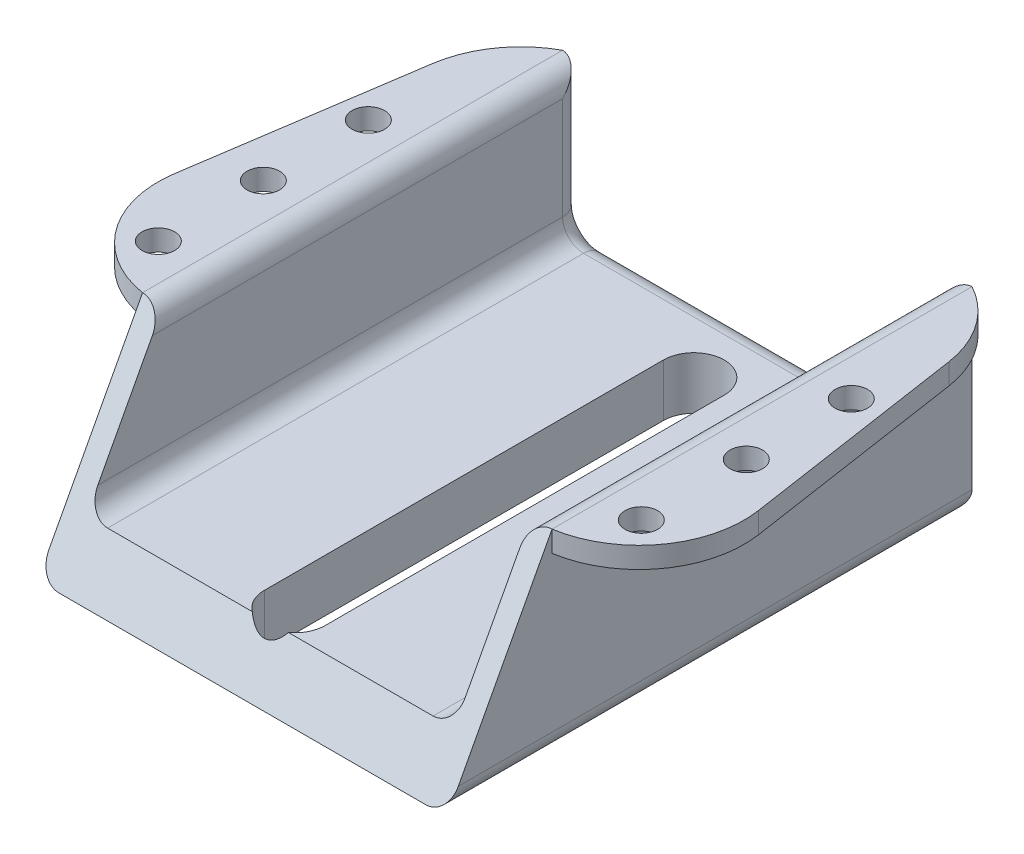
from build123d import *

# Parameters (mm, degrees)
SKETCH2_W           = 35
SKETCH2_H           = 50
BOSS_EXTRUDE1_DEPTH = 5
BOSS_EXTRUDE2_DEPTH = 2
SKETCH4_R           = 1.55
BOSS_EXTRUDE3_DEPTH = 2
FILLET1_R           = 2
FILLET2_R           = 10
CUT_EXTRUDE1_DEPTH  = 40.91088123
CUT_EXTRUDE2_DEPTH  = 56.121529602


# Some blends are built 0.0001 mm under size
with BuildPart() as part:
    # Sketch2 → Boss-Extrude1 (new body)
    with BuildSketch(Plane(origin=(0, 0, 0), x_dir=(1, 0, 0), z_dir=(0, 1, 0))):
        Rectangle(SKETCH2_W, SKETCH2_H)
    extrude(amount=BOSS_EXTRUDE1_DEPTH)

    # Sketch3 → Boss-Extrude2 (add)
    with BuildSketch(Plane(origin=(17.5, 0, 0), x_dir=(0, 0, -1), z_dir=(1, 0, 0))):
        Polygon((-25, 0), (-15, 18.75), (25, 18.75), (25, 0), align=None)
    boss_extrude2 = extrude(amount=BOSS_EXTRUDE2_DEPTH)

    # Mirror1: Boss-Extrude2 across plane
    add(boss_extrude2.mirror(Plane(origin=(0, 0, 0), x_dir=(0, 0, 1), z_dir=(1, 0, 0))))

    # Sketch4 → Boss-Extrude3 (add)
    with BuildSketch(Plane(origin=(0, 18.75, 0), x_dir=(1, 0, 0), z_dir=(0, 1, 0))):
        Polygon((-19.5, -15), (-29.5, -15), (-23.5, 25), (-19.5, 25), align=None)
        with Locations(Location((-23, -10, 0), (0, 0, 270))):
            Circle(SKETCH4_R, mode=Mode.SUBTRACT)
        with Locations(Location((-23, 0, 0), (0, 0, 270))):
            Circle(SKETCH4_R, mode=Mode.SUBTRACT)
        with Locations(Location((-23, 10, 0), (0, 0, 270))):
            Circle(SKETCH4_R, mode=Mode.SUBTRACT)
    boss_extrude3 = extrude(amount=-BOSS_EXTRUDE3_DEPTH)

    # Fillet1
    fillet1_edges = [part.edges().sort_by_distance(p)[0] for p in [
        (-17.5, 5, -1.333333333),
        (17.5, 5, -1.333333333),
        (17.5, 18.75, -5),
        (19.5, 0, 0),
        (-17.5, 11.875, -25),
        (-17.5, 18.75, -5),
        (-19.5, 0, 0),
        (17.5, 11.875, -25),
        (0, 0, -25),
        (0, 5, -25),
    ]]
    fillet(fillet1_edges, radius=FILLET1_R - 0.0001)  # a hair under: the kernel refuses the full size

    # Mirror2: Boss-Extrude3 across plane
    add(boss_extrude3.mirror(Plane(origin=(0, 0, 0), x_dir=(0, 0, 1), z_dir=(1, 0, 0))))

    # Fillet2
    # the kernel refuses this fillet: 10 mm, written as the material it takes off along each edge
    with BuildSketch(Plane(origin=(-29.5, 47.456981223, 15), x_dir=(1, 0, 0), z_dir=(0, -1, 0))) as fillet2_piece_1:
        with BuildLine():
            CenterArc((11.592726167, -9.872346396), FILLET2_R, 99.164678829, 89.366086781)
            Line((1.703362639, -11.355750925), (0, 0))
            Line((0, 0), (10, 0))
        make_face()
    extrude(amount=59.413962446, mode=Mode.SUBTRACT)
    with BuildSketch(Plane(origin=(29.5, 47.456981223, 15), x_dir=(-0.1483404529302447, 0, -0.9889363528682975), z_dir=(0, -1, 0))) as fillet2_piece_2:
        with BuildLine():
            CenterArc((11.482792489, -10), FILLET2_R, 90, 89.366086781)
            Line((1.483404529, -9.889363529), (0, 0))
            Line((0, 0), (11.482792489, 0))
        make_face()
    extrude(amount=59.413962446, mode=Mode.SUBTRACT)
    with BuildSketch(Plane(origin=(-23.5, 37.183288466, -25), x_dir=(1.0, 0, 1.2229911091485247e-12), z_dir=(0, -1, 0))) as fillet2_piece_3:
        with BuildLine():
            CenterArc((8.795602585, 8.775144156), FILLET2_R, 188.53076561, 52.813201583)
            Line((-1.093760944, 7.291739627), (0, 0))
            Line((0, 0), (4.0001, 0))
        make_face()
    extrude(amount=38.866576932, mode=Mode.SUBTRACT)
    with BuildSketch(Plane(origin=(23.5, 37.183288466, -25), x_dir=(-1.0, 0, 1.2229911091485247e-12), z_dir=(0, -1, 0))) as fillet2_piece_4:
        with BuildLine():
            CenterArc((8.795602585, -8.775144156), FILLET2_R, 118.656032807, 52.813201583)
            Line((-1.093760944, -7.291739627), (0, 0))
            Line((0, 0), (4.0001, 0))
        make_face()
    extrude(amount=38.866576932, mode=Mode.SUBTRACT)

    # Sketch5 → Cut-Extrude1 (cut, through all)
    with BuildSketch(Plane(origin=(0, 5, 0), x_dir=(1, 0, 0), z_dir=(0, 1, 0))):
        with BuildLine():
            Line((2.9, 18), (2.9, -20))
            ThreePointArc((2.9, -20), (0, -22.9), (-2.9, -20))
            Line((-2.9, -20), (-2.9, 18))
            ThreePointArc((-2.9, 18), (0, 20.9), (2.9, 18))
        make_face()
    extrude(amount=-CUT_EXTRUDE1_DEPTH, mode=Mode.SUBTRACT)

    # Sketch6 → Cut-Extrude2 (cut, through all)
    with BuildSketch(Plane.ZY.offset(17.5)):
        Polygon((25, 5), (22.333333333, 5), (25, 0), align=None)
    extrude(amount=-CUT_EXTRUDE2_DEPTH, mode=Mode.SUBTRACT)


solid = part.part
